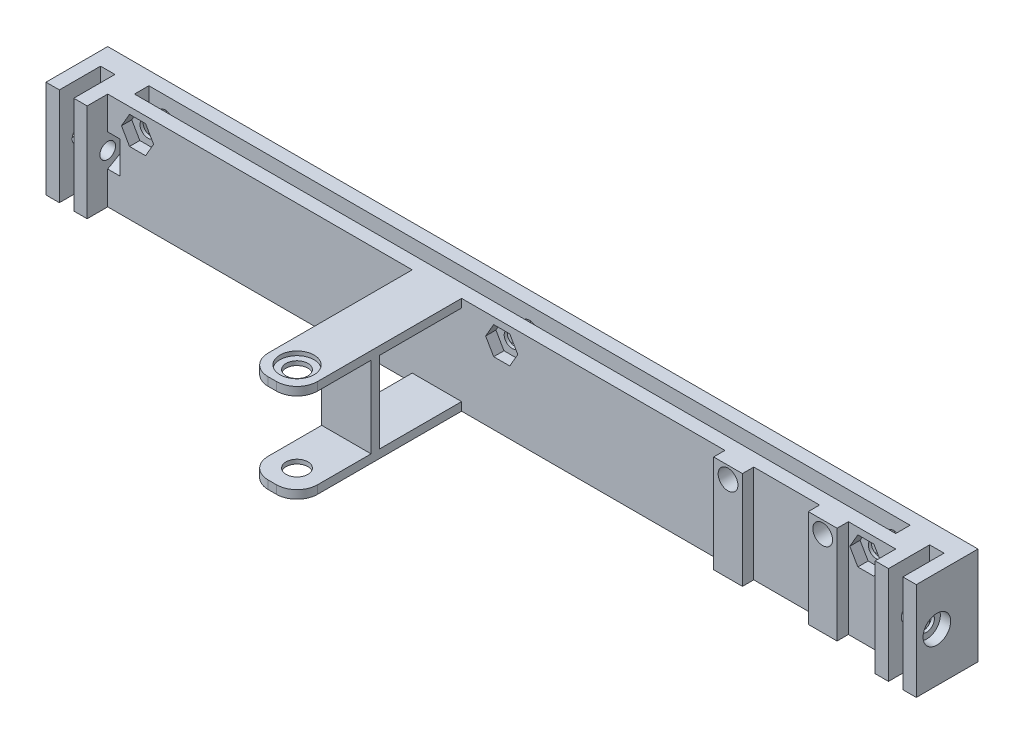
from build123d import *

# Parameters (mm, degrees)
SKETCH2_W            = 23.75
SKETCH2_H            = 12
BOSS_EXTRUDE1_DEPTH  = 10
SKETCH3_W            = 12
SKETCH3_H            = 2.025
BOSS_EXTRUDE2_DEPTH  = 40
FILLET1_R            = 5
FILLET1_OF_MIRROR1_R = 5
SKETCH5_R            = 2.65
CUT_EXTRUDE1_DEPTH   = 57.639760769
SKETCH6_R            = 4.15
CUT_EXTRUDE2_DEPTH   = 1
SKETCH7_W            = 84
SKETCH7_H            = 23.75
SKETCH7_W_2          = 115.5
BOSS_EXTRUDE3_DEPTH  = 10
SKETCH8_W            = 10
SKETCH8_H            = 23.75
BOSS_EXTRUDE4_DEPTH  = 5
BOSS_EXTRUDE7_REACH  = 130.079
SKETCH18_W           = 12
SKETCH18_H           = 2
SKETCH11_W           = 185
SKETCH11_H           = 3.5
CUT_EXTRUDE3_DEPTH   = 10
SKETCH12_R           = 1.9
CUT_EXTRUDE4_DEPTH   = 155.807138078
SKETCH15_R           = 3.35
CUT_EXTRUDE5_DEPTH   = 2.5
SKETCH16_R           = 1.9
CUT_EXTRUDE6_DEPTH   = 2.5
LPATTERN1_COUNT      = 3
LPATTERN1_PITCH      = 88.5
SKETCH14_W           = 7
SKETCH14_H           = 23.75
BOSS_EXTRUDE6_DEPTH  = 2.75
CUT_EXTRUDE7_REACH   = 130.079
SKETCH21_W           = 3.5
SKETCH21_H           = 10
LPATTERN2_COUNT      = 2
LPATTERN2_PITCH      = 201.5
SKETCH22_R           = 2.4
CUT_EXTRUDE8_DEPTH   = 3.8
SKETCH26_R           = 1.75
CUT_EXTRUDE12_DEPTH  = 0.6
LPATTERN3_COUNT      = 2
LPATTERN3_PITCH      = 23
SKETCH23_R           = 1.9
CUT_EXTRUDE9_DEPTH   = 10
SKETCH24_R           = 3.35
CUT_EXTRUDE10_DEPTH  = 2.5
CUT_EXTRUDE11_DEPTH  = 3


with BuildPart() as part:
    # Sketch2 → Boss-Extrude1 (new body)
    with BuildSketch(Plane(origin=(0, 0, 0), x_dir=(0, 1, 0), z_dir=(0, 0, 1))):
        with Locations((-83.125, 6)):
            Rectangle(SKETCH2_W, SKETCH2_H)
    extrude(amount=BOSS_EXTRUDE1_DEPTH)

    # Sketch3 → Boss-Extrude2 (add)
    with BuildSketch(Plane.XY.offset(10)):
        with Locations((-6, -72.2625)):
            Rectangle(SKETCH3_W, SKETCH3_H)
    boss_extrude2 = extrude(amount=BOSS_EXTRUDE2_DEPTH)

    # Fillet1
    fillet1_edges = [part.edges().sort_by_distance(p)[0] for p in [
        (0, -72.2625, 50),
        (-12, -72.2625, 50),
    ]]
    fillet(fillet1_edges, radius=FILLET1_R)

    # Mirror1: Boss-Extrude2 across plane
    add(boss_extrude2.mirror(Plane.ZX.offset(-83.125)))

    # Fillet1 of Mirror1
    fillet1_of_mirror1_edges = [part.edges().sort_by_distance(p)[0] for p in [
        (0, -93.9875, 50),
        (-12, -93.9875, 50),
    ]]
    fillet(fillet1_of_mirror1_edges, radius=FILLET1_OF_MIRROR1_R)

    # Sketch5 → Cut-Extrude1 (cut, through all)
    with BuildSketch(Plane.XZ.offset(95)):
        with Locations((-6, 44)):
            Circle(SKETCH5_R)
    extrude(amount=-CUT_EXTRUDE1_DEPTH, mode=Mode.SUBTRACT)

    # Sketch6 → Cut-Extrude2 (cut)
    with BuildSketch(Plane.XZ.offset(95)):
        with Locations((-6, 44)):
            Circle(SKETCH6_R)
    cut_extrude2 = extrude(amount=-CUT_EXTRUDE2_DEPTH, mode=Mode.SUBTRACT)

    # Mirror2: Cut-Extrude2 across plane
    add(cut_extrude2.mirror(Plane.ZX.offset(-83.125)), mode=Mode.SUBTRACT)

    # Sketch7 → Boss-Extrude3 (add)
    with BuildSketch(Plane(origin=(0, 0, 0), x_dir=(1, 0, 0), z_dir=(0, 0, -1))):
        with Locations((-54, 83.125)):
            Rectangle(SKETCH7_W, SKETCH7_H)
        with Locations((57.75, 83.125)):
            Rectangle(SKETCH7_W_2, SKETCH7_H)
    extrude(amount=-BOSS_EXTRUDE3_DEPTH)

    # Sketch8 → Boss-Extrude4 (add)
    with BuildSketch(Plane.XY.offset(10)):
        with Locations((110.5, -83.125)):
            Rectangle(SKETCH8_W, SKETCH8_H)
        with Locations((-91, -83.125)):
            Rectangle(SKETCH8_W, SKETCH8_H)
    extrude(amount=BOSS_EXTRUDE4_DEPTH)

    # Sketch18 → Boss-Extrude7 (add, up to next)
    with BuildSketch(Plane(origin=(0, -71.25, 0), x_dir=(-1, 0, 0), z_dir=(0, 1, 0)), mode=Mode.PRIVATE) as boss_extrude7_sk1:
        with Locations((6, 31)):
            Rectangle(SKETCH18_W, SKETCH18_H)
    boss_extrude7_tool1 = extrude(boss_extrude7_sk1.sketch, amount=-BOSS_EXTRUDE7_REACH, mode=Mode.PRIVATE) - part.part
    add(boss_extrude7_tool1.solids().sort_by_distance((-6, -71.25, 31))[0])

    # Sketch11 → Cut-Extrude3 (cut)
    with BuildSketch(Plane(origin=(0, -71.25, 0), x_dir=(-1, 0, 0), z_dir=(0, 1, 0))):
        with Locations((-9.75, 5)):
            Rectangle(SKETCH11_W, SKETCH11_H)
    cut_extrude3 = extrude(amount=-CUT_EXTRUDE3_DEPTH, mode=Mode.SUBTRACT)

    # Mirror3: Cut-Extrude3 across plane
    add(cut_extrude3.mirror(Plane.ZX.offset(-83.125)), mode=Mode.SUBTRACT)

    # Sketch12 → Cut-Extrude4 (cut, symmetric)
    with BuildSketch(Plane.XY.offset(10)):
        with Locations((-78.75, -76.25)):
            Circle(SKETCH12_R)
    cut_extrude4 = extrude(amount=CUT_EXTRUDE4_DEPTH, both=True, mode=Mode.SUBTRACT)

    # Sketch15 → Cut-Extrude5 (cut)
    with BuildSketch(Plane.XY):
        with Locations((-78.75, -76.25)):
            Circle(SKETCH15_R)
    cut_extrude5 = extrude(amount=CUT_EXTRUDE5_DEPTH, mode=Mode.SUBTRACT)

    # Sketch16 → Cut-Extrude6 (cut)
    with BuildSketch(Plane.XY.offset(10)):
        Polygon((-80.702072594, -72.868911087), (-82.654145188, -76.25), (-80.702072594, -79.631088913), (-76.797927406, -79.631088913), (-74.845854812, -76.25), (-76.797927406, -72.868911087), align=None)
        with Locations((-78.75, -76.25)):
            Circle(SKETCH16_R, mode=Mode.SUBTRACT)
    cut_extrude6 = extrude(amount=-CUT_EXTRUDE6_DEPTH, mode=Mode.SUBTRACT)

    # LPattern1: Cut-Extrude4, Cut-Extrude5, Cut-Extrude6 ×3
    with Locations(*[(i * LPATTERN1_PITCH, 0, 0) for i in range(1, LPATTERN1_COUNT)]):
        add(cut_extrude4, mode=Mode.SUBTRACT)
        add(cut_extrude5, mode=Mode.SUBTRACT)
        add(cut_extrude6, mode=Mode.SUBTRACT)

    # Sketch14 → Boss-Extrude6 (add)
    with BuildSketch(Plane.XY.offset(10)):
        with Locations((90.5, -83.125)):
            Rectangle(SKETCH14_W, SKETCH14_H)
        with Locations((67.5, -83.125)):
            Rectangle(SKETCH14_W, SKETCH14_H)
    extrude(amount=BOSS_EXTRUDE6_DEPTH)

    # Sketch21 → Cut-Extrude7 (cut, up to next)
    with BuildSketch(Plane(origin=(0, -71.25, 0), x_dir=(-1, 0, 0), z_dir=(0, 1, 0)), mode=Mode.PRIVATE) as cut_extrude7_sk1:
        with Locations((-110.5, 10)):
            Rectangle(SKETCH21_W, SKETCH21_H)
    cut_extrude7_tool1 = extrude(cut_extrude7_sk1.sketch, amount=-CUT_EXTRUDE7_REACH, mode=Mode.PRIVATE) & part.part
    cut_extrude7 = cut_extrude7_tool1.solids().sort_by_distance((110.5, -71.25, 10))[0]
    add(cut_extrude7, mode=Mode.SUBTRACT)

    # LPattern2: Cut-Extrude7 ×2
    with Locations(*[(-i * LPATTERN2_PITCH, 0, 0) for i in range(1, LPATTERN2_COUNT)]):
        add(cut_extrude7, mode=Mode.SUBTRACT)

    # Sketch22 → Cut-Extrude8 (cut)
    with BuildSketch(Plane.XY.offset(12.75)):
        with Locations((90.5, -74.25)):
            Circle(SKETCH22_R)
    cut_extrude8 = extrude(amount=-CUT_EXTRUDE8_DEPTH, mode=Mode.SUBTRACT)

    # Sketch26 → Cut-Extrude12 (cut)
    with BuildSketch(Plane.XY.offset(8.95)):
        with Locations((90.5, -74.25)):
            Circle(SKETCH26_R)
    cut_extrude12 = extrude(amount=-CUT_EXTRUDE12_DEPTH, mode=Mode.SUBTRACT)

    # LPattern3: Cut-Extrude8, Cut-Extrude12 ×2
    with Locations(*[(-i * LPATTERN3_PITCH, 0, 0) for i in range(1, LPATTERN3_COUNT)]):
        add(cut_extrude8, mode=Mode.SUBTRACT)
        add(cut_extrude12, mode=Mode.SUBTRACT)

    # Sketch23 → Cut-Extrude9 (cut)
    with BuildSketch(Plane.YZ.offset(115.5)):
        with Locations((-83.125, 10)):
            Circle(SKETCH23_R)
    cut_extrude9 = extrude(amount=-CUT_EXTRUDE9_DEPTH, mode=Mode.SUBTRACT)

    # Sketch24 → Cut-Extrude10 (cut)
    with BuildSketch(Plane.YZ.offset(115.5)):
        with Locations((-83.125, 10)):
            Circle(SKETCH24_R)
    cut_extrude10 = extrude(amount=-CUT_EXTRUDE10_DEPTH, mode=Mode.SUBTRACT)

    # Sketch25 → Cut-Extrude11 (cut)
    with BuildSketch(Plane(origin=(105.5, 0, 0), x_dir=(0, -1, 0), z_dir=(-1, 0, 0))):
        Polygon((81.172927406, 13.381088913), (79.220854812, 10), (81.172927406, 6.618911087), (85.077072594, 6.618911087), (87.029145188, 10), (85.077072594, 13.381088913), align=None)
    cut_extrude11 = extrude(amount=CUT_EXTRUDE11_DEPTH, mode=Mode.SUBTRACT)

    # Mirror4: Cut-Extrude9, Cut-Extrude10, Cut-Extrude11 across plane
    add(cut_extrude9.mirror(Plane(origin=(9.75, 0, 0), x_dir=(0, 0, 1), z_dir=(1, 0, 0))), mode=Mode.SUBTRACT)
    add(cut_extrude10.mirror(Plane(origin=(9.75, 0, 0), x_dir=(0, 0, 1), z_dir=(1, 0, 0))), mode=Mode.SUBTRACT)
    add(cut_extrude11.mirror(Plane(origin=(9.75, 0, 0), x_dir=(0, 0, 1), z_dir=(1, 0, 0))), mode=Mode.SUBTRACT)


solid = part.part
